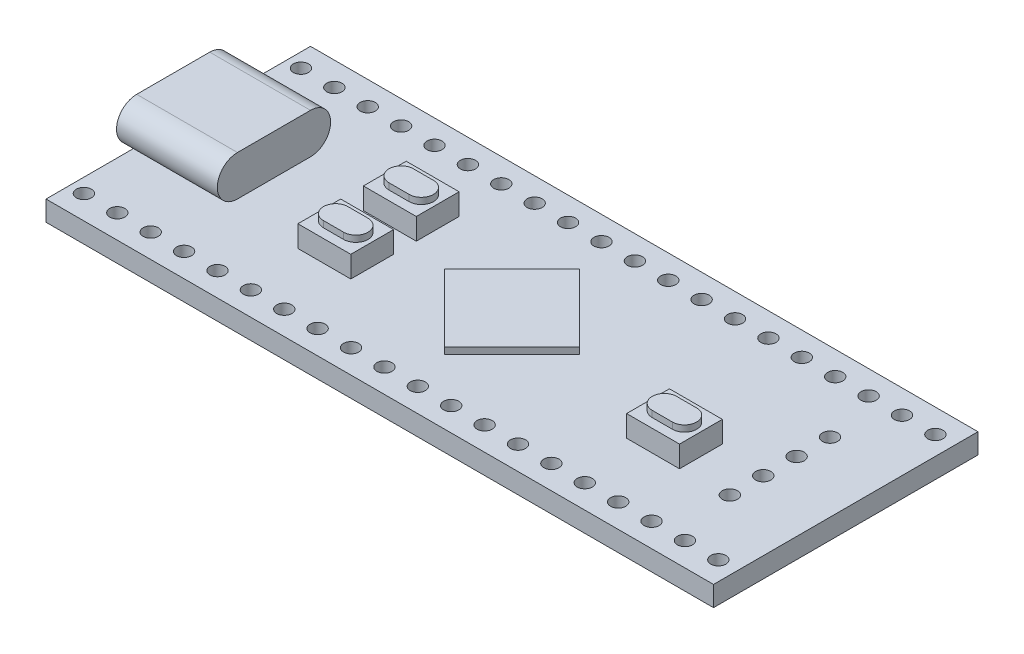
from build123d import *

# Parameters (mm, degrees)
SKETCH1_W                 = 53
SKETCH1_H                 = 21
BOSS_EXTRUDE1_DEPTH       = 1.6
BOSS_EXTRUDE2_DEPTH       = 0.4
BOSS_EXTRUDE2_DEPTH_BACK  = 7.6
SKETCH3_W                 = 4.2
SKETCH3_H                 = 3.4
BOSS_EXTRUDE3_DEPTH       = 1.7
BOSS_EXTRUDE4_DEPTH       = 0.5
SKETCH_PATTERN1_START     = 1.6
SKETCH_PATTERN1_OUTLINE_W = 4.2
SKETCH_PATTERN1_OUTLINE_H = 3.4
SKETCH_PATTERN1_DEPTH     = 1.7
SKETCH_PATTERN1_START_2   = 3.3
SKETCH_PATTERN1_2_DEPTH   = 0.5
SKETCH6_R                 = 0.6
CUT_EXTRUDE1_DEPTH        = 30.053399113
LPATTERN1_COUNT           = 20
LPATTERN1_PITCH           = 2.65128085
BOSS_EXTRUDE5_DEPTH       = 0.5
SKETCH8_R                 = 0.6
CUT_EXTRUDE2_DEPTH        = 30.053399113
LPATTERN2_COUNT           = 4
LPATTERN2_PITCH           = 2.65128085


# Read off the part's stored shape, not the designer's step: Sketch-Pattern1
with BuildPart() as part:
    # Sketch1 → Boss-Extrude1 (new body)
    with BuildSketch(Plane(origin=(0, 0, 0), x_dir=(1, 0, 0), z_dir=(0, 1, 0))):
        Rectangle(SKETCH1_W, SKETCH1_H)
    extrude(amount=BOSS_EXTRUDE1_DEPTH)

    # Sketch2 → Boss-Extrude2 (add, two sides: drawn at the far end of the back side and taken through both)
    with BuildSketch(Plane.ZY.offset(26.5).offset(-BOSS_EXTRUDE2_DEPTH_BACK)):
        with BuildLine():
            Line((-2.9, 4.8), (2.9, 4.8))
            ThreePointArc((2.9, 4.8), (4.5, 3.2), (2.9, 1.6))
            Line((2.9, 1.6), (-2.9, 1.6))
            ThreePointArc((-2.9, 1.6), (-4.5, 3.2), (-2.9, 4.8))
        make_face()
    extrude(amount=BOSS_EXTRUDE2_DEPTH + BOSS_EXTRUDE2_DEPTH_BACK)

    # Sketch3 → Boss-Extrude3 (add)
    with BuildSketch(Plane(origin=(0, 1.6, 0), x_dir=(1, 0, 0), z_dir=(0, 1, 0))):
        with Locations((15.1, -2.2)):
            Rectangle(SKETCH3_W, SKETCH3_H)
    extrude(amount=BOSS_EXTRUDE3_DEPTH)

    # Sketch4 → Boss-Extrude4 (add)
    with BuildSketch(Plane(origin=(0, 3.3, 0), x_dir=(1, 0, 0), z_dir=(0, 1, 0))):
        with BuildLine():
            Line((14.3, -1.234969734), (15.9, -1.234969734))
            ThreePointArc((15.9, -1.234969734), (16.865030266, -2.2), (15.9, -3.165030266))
            Line((15.9, -3.165030266), (14.3, -3.165030266))
            ThreePointArc((14.3, -3.165030266), (13.334969734, -2.2), (14.3, -1.234969734))
        make_face()
    extrude(amount=BOSS_EXTRUDE4_DEPTH)

    # Sketch-Pattern1 outline → Sketch-Pattern1 (add)
    with BuildSketch(Plane(origin=(0, 0, 0), x_dir=(1, 0, 0), z_dir=(0, 1, 0)).offset(SKETCH_PATTERN1_START)):
        with Locations((-11, -2.2)):
            Rectangle(SKETCH_PATTERN1_OUTLINE_W, SKETCH_PATTERN1_OUTLINE_H)
        with Locations((-11, 3)):
            Rectangle(SKETCH_PATTERN1_OUTLINE_W, SKETCH_PATTERN1_OUTLINE_H)
    extrude(amount=SKETCH_PATTERN1_DEPTH)

    # Sketch-Pattern1 2 outline → Sketch-Pattern1 2 (add)
    with BuildSketch(Plane(origin=(0, 0, 0), x_dir=(1, 0, 0), z_dir=(0, 1, 0)).offset(SKETCH_PATTERN1_START_2)):
        with BuildLine():
            Line((-11.8, -3.165030266), (-10.2, -3.165030266))
            ThreePointArc((-10.2, -3.165030266), (-9.234969734, -2.2), (-10.2, -1.234969734))
            Line((-10.2, -1.234969734), (-11.8, -1.234969734))
            ThreePointArc((-11.8, -1.234969734), (-12.765030266, -2.2), (-11.8, -3.165030266))
        make_face()
        with BuildLine():
            ThreePointArc((-11.8, 3.965030266), (-12.765030266, 3), (-11.8, 2.034969734))
            Line((-11.8, 2.034969734), (-10.2, 2.034969734))
            ThreePointArc((-10.2, 2.034969734), (-9.234969734, 3), (-10.2, 3.965030266))
            Line((-10.2, 3.965030266), (-11.8, 3.965030266))
        make_face()
    extrude(amount=SKETCH_PATTERN1_2_DEPTH)

    # Sketch6 → Cut-Extrude1 (cut, through all)
    with BuildSketch(Plane(origin=(0, 1.6, 0), x_dir=(1, 0, 0), z_dir=(0, 1, 0))):
        with Locations(Location((-25.374336146, 8.615861733, 0), (0, 0, 270))):
            Circle(SKETCH6_R)
        with Locations(Location((-25.374336146, -8.615861733, 0), (0, 0, 90))):
            Circle(SKETCH6_R)
    cut_extrude1 = extrude(amount=-CUT_EXTRUDE1_DEPTH, mode=Mode.SUBTRACT)

    # LPattern1: Cut-Extrude1 ×20
    with Locations(*[(i * LPATTERN1_PITCH, 0, 0) for i in range(1, LPATTERN1_COUNT)]):
        add(cut_extrude1, mode=Mode.SUBTRACT)

    # Sketch7 → Boss-Extrude5 (add)
    with BuildSketch(Plane(origin=(0, 1.6, 0), x_dir=(1, 0, 0), z_dir=(0, 1, 0))):
        Polygon((-5.374011537, 0), (0, 5.374011537), (5.374011537, 0), (0, -5.374011537), align=None)
    extrude(amount=BOSS_EXTRUDE5_DEPTH)

    # Sketch8 → Cut-Extrude2 (cut, through all)
    with BuildSketch(Plane(origin=(0, 1.6, 0), x_dir=(1, 0, 0), z_dir=(0, 1, 0))):
        with Locations(Location((21, 4.25, 0), (0, 0, 270))):
            Circle(SKETCH8_R)
    cut_extrude2 = extrude(amount=-CUT_EXTRUDE2_DEPTH, mode=Mode.SUBTRACT)

    # LPattern2: Cut-Extrude2 ×4
    with Locations(*[(0, 0, i * LPATTERN2_PITCH) for i in range(1, LPATTERN2_COUNT)]):
        add(cut_extrude2, mode=Mode.SUBTRACT)


solid = part.part
